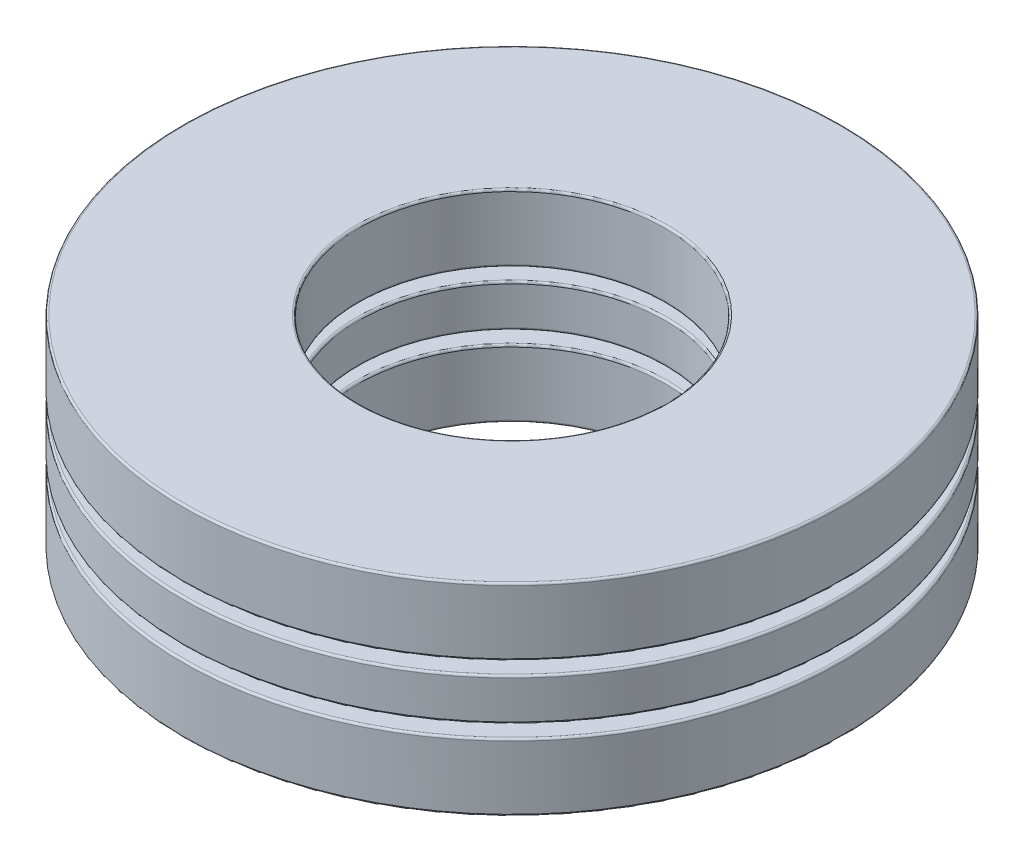
from build123d import *

# Parameters (mm, degrees)
SKETCH1_W         = 5.51815
SKETCH1_H         = 1.317625
CIRPATTERN1_COUNT = 4
CIRPATTERN1_ANGLE = 270
CIRPATTERN2_COUNT = 4
SKETCH4_W         = 5.51815
SKETCH4_H         = 2.1082
FILLET1_R         = 0.063246
FILLET2_R         = 0.063246
FILLET3_R         = 0.063246


with BuildPart() as part:
    # Sketch1 → Revolve1 (revolve)
    with BuildSketch(Plane(origin=(0, 0, 0), x_dir=(0, 0, -1), z_dir=(1, 0, 0))):
        with Locations((-7.559675, 0)):
            Rectangle(SKETCH1_W, SKETCH1_H)
    revolve(axis=Axis((0, -3.1623, 0), (0, 1, 0)))

    # Sketch3 → Cut-Revolve1 (revolve, cut)
    with BuildSketch(Plane(origin=(0, 0, 0), x_dir=(0, 0, -1), z_dir=(1, 0, 0))):
        with BuildLine():
            Line((-7.559675, 1.0541), (-7.559675, -1.0541))
            ThreePointArc((-7.559675, -1.0541), (-8.613775, 0), (-7.559675, 1.0541))
        make_face()
    cut_revolve1 = revolve(axis=Axis((0, 1.0541, 7.559675), (0, -1, 0)), mode=Mode.SUBTRACT)

    # CirPattern2: Cut-Revolve1 ×4 about axis
    cirpattern2_axis = Axis((0, 3.1623, 0), (0, -1, 0))
    for i in range(1, CIRPATTERN2_COUNT):
        add(cut_revolve1.rotate(cirpattern2_axis, i * 360 / CIRPATTERN2_COUNT), mode=Mode.SUBTRACT)

    # Fillet2
    fillet2_edges = [part.edges().sort_by_distance(p)[0] for p in [
        (0, -0.6588125, -4.8006),
        (0, 0.6588125, -4.8006),
        (0, -0.6588125, -10.31875),
        (0, 0.6588125, -10.31875),
    ]]
    fillet(fillet2_edges, radius=FILLET2_R)


with BuildPart() as body_2:
    # Sketch2 → Revolve2 (revolve)
    with BuildSketch(Plane(origin=(0, 0, 0), x_dir=(0, 0, -1), z_dir=(1, 0, 0))):
        with BuildLine():
            Line((-7.559675, 1.0541), (-7.559675, -1.0541))
            ThreePointArc((-7.559675, -1.0541), (-8.613775, 0), (-7.559675, 1.0541))
        make_face()
    revolve(axis=Axis((0, 1.0541, 7.559675), (0, -1, 0)))


with BuildPart() as cirpattern1_1:
    # CirPattern1: pattern copy
    add(body_2.part.rotate(Axis((0, 3.1623, 0), (0, -1, 0)), 1 * CIRPATTERN1_ANGLE / (CIRPATTERN1_COUNT - 1)))


with BuildPart() as cirpattern1_2:
    # CirPattern1: pattern copy
    add(body_2.part.rotate(Axis((0, 3.1623, 0), (0, -1, 0)), 2 * CIRPATTERN1_ANGLE / (CIRPATTERN1_COUNT - 1)))


with BuildPart() as cirpattern1_3:
    # CirPattern1: pattern copy
    add(body_2.part.rotate(Axis((0, 3.1623, 0), (0, -1, 0)), 3 * CIRPATTERN1_ANGLE / (CIRPATTERN1_COUNT - 1)))


with BuildPart() as body_6:
    # Sketch4 → Revolve3 (revolve)
    with BuildSketch(Plane(origin=(0, 0, 0), x_dir=(0, 0, -1), z_dir=(1, 0, 0))):
        with Locations((-7.559675, 2.1082)):
            Rectangle(SKETCH4_W, SKETCH4_H)
        with Locations((-7.559675, -2.1082)):
            Rectangle(SKETCH4_W, SKETCH4_H)
    revolve(axis=Axis((0, -3.1623, 0), (0, 1, 0)))

    # Fillet1
    fillet1_edges = [body_6.edges().sort_by_distance(p)[0] for p in [
        (0, 1.0541, -4.8006),
        (0, 3.1623, -4.8006),
        (0, 1.0541, -10.31875),
        (0, 3.1623, -10.31875),
    ]]
    fillet(fillet1_edges, radius=FILLET1_R)

    # Fillet3
    fillet3_edges = [body_6.edges().sort_by_distance(p)[0] for p in [
        (0, -3.1623, -4.8006),
        (0, -1.0541, -4.8006),
        (0, -3.1623, -10.31875),
        (0, -1.0541, -10.31875),
    ]]
    fillet(fillet3_edges, radius=FILLET3_R)


solid = Compound([part.part, body_2.part, cirpattern1_1.part, cirpattern1_2.part, cirpattern1_3.part, body_6.part])
